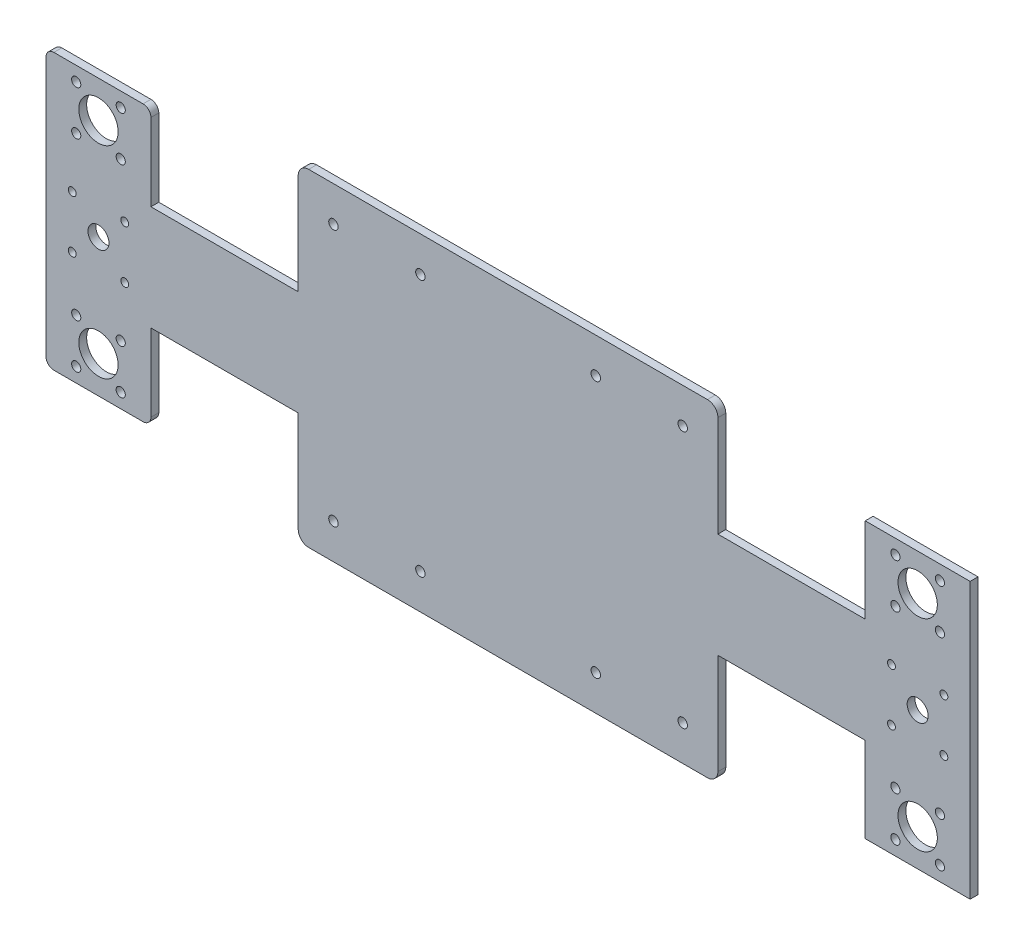
from build123d import *

# Parameters (mm, degrees)
SKETCH_1_W      = 352.3
SKETCH_1_H      = 40
SKETCH_1_R      = 4
SKETCH_1_R_2    = 1.5
EXTRUDE_1_DEPTH = 3
FILLET_1_R      = 7
SKETCH_2_R      = 1.8
EXTRUDE_2_DEPTH = 3
FILLET_2_R      = 4
SKETCH_3_R      = 1.75
SKETCH_3_R_2    = 7.5
EXTRUDE_3_DEPTH = 3
FILLET_3_R      = 3


with BuildPart() as part:
    # 스케치1 → 보스-돌출1 (new body)
    with BuildSketch(Plane.XY):
        Rectangle(SKETCH_1_W, SKETCH_1_H)
        with Locations((-156.15, 0)):
            Circle(SKETCH_1_R, mode=Mode.SUBTRACT)
        with Locations((-146.15, -10)):
            Circle(SKETCH_1_R_2, mode=Mode.SUBTRACT)
        with Locations((-146.15, 10)):
            Circle(SKETCH_1_R_2, mode=Mode.SUBTRACT)
        with Locations((-166.15, -10)):
            Circle(SKETCH_1_R_2, mode=Mode.SUBTRACT)
        with Locations((-166.15, 10)):
            Circle(SKETCH_1_R_2, mode=Mode.SUBTRACT)
        with Locations((146.15, 10)):
            Circle(SKETCH_1_R_2, mode=Mode.SUBTRACT)
        with Locations((156.15, 0)):
            Circle(SKETCH_1_R, mode=Mode.SUBTRACT)
        with Locations((146.15, -10)):
            Circle(SKETCH_1_R_2, mode=Mode.SUBTRACT)
        with Locations((166.15, -10)):
            Circle(SKETCH_1_R_2, mode=Mode.SUBTRACT)
        with Locations((166.15, 10)):
            Circle(SKETCH_1_R_2, mode=Mode.SUBTRACT)
    extrude(amount=EXTRUDE_1_DEPTH)

    # 필렛1
    fillet_1_edges = [part.edges().sort_by_distance(p)[0] for p in [
        (-176.15, -20, 1.5),
        (-176.15, 20, 1.5),
        (176.15, -20, 1.5),
        (176.15, 20, 1.5),
    ]]
    fillet(fillet_1_edges, radius=FILLET_1_R)

    # 스케치2 → 보스-돌출2 (add)
    with BuildSketch(Plane.XY.offset(3)):
        Polygon((-80, -62.43), (80, -62.43), (80, -20), (66.575, -20), (66.575, 20), (80, 20), (80, 62.43), (-80, 62.43), align=None)
        with Locations((-66.575, -49)):
            Circle(SKETCH_2_R, mode=Mode.SUBTRACT)
        with Locations((-33.425, -49)):
            Circle(SKETCH_2_R, mode=Mode.SUBTRACT)
        with Locations((33.425, -49)):
            Circle(SKETCH_2_R, mode=Mode.SUBTRACT)
        with Locations((66.575, -49)):
            Circle(SKETCH_2_R, mode=Mode.SUBTRACT)
        with Locations((66.575, 49)):
            Circle(SKETCH_2_R, mode=Mode.SUBTRACT)
        with Locations((33.425, 49)):
            Circle(SKETCH_2_R, mode=Mode.SUBTRACT)
        with Locations((-33.425, 49)):
            Circle(SKETCH_2_R, mode=Mode.SUBTRACT)
        with Locations((-66.575, 49)):
            Circle(SKETCH_2_R, mode=Mode.SUBTRACT)
    extrude(amount=-EXTRUDE_2_DEPTH)

    # 필렛2
    fillet_2_edges = [part.edges().sort_by_distance(p)[0] for p in [
        (-80, -62.43, 1.5),
        (80, -62.43, 1.5),
        (80, 62.43, 1.5),
        (-80, 62.43, 1.5),
    ]]
    fillet(fillet_2_edges, radius=FILLET_2_R)

    # 스케치3 → 보스-돌출3 (add)
    # profile 1 of 2: a face of its own
    with BuildSketch(Plane.XY.offset(3)):
        with BuildLine():
            Line((-176.15, -13), (-176.15, -52.470562748))
            Line((-176.15, -52.470562748), (-136.15, -52.470562748))
            Line((-136.15, -52.470562748), (-136.15, -20))
            Line((-136.15, -20), (-169.15, -20))
            ThreePointArc((-169.15, -20), (-174.099747468, -17.949747468), (-176.15, -13))
        make_face()
        with Locations((-164.635281374, -46.970562748)):
            Circle(SKETCH_3_R, mode=Mode.SUBTRACT)
        with Locations((-147.664718626, -46.970562748)):
            Circle(SKETCH_3_R, mode=Mode.SUBTRACT)
        with Locations((-147.664718626, -30)):
            Circle(SKETCH_3_R, mode=Mode.SUBTRACT)
        with Locations((-164.635281374, -30)):
            Circle(SKETCH_3_R, mode=Mode.SUBTRACT)
        with Locations((-156.15, -38.485281374)):
            Circle(SKETCH_3_R_2, mode=Mode.SUBTRACT)
    # profile 2 of 2: a face of its own
    with BuildSketch(Plane.XY.offset(3)):
        with BuildLine():
            Line((-176.15, 52.470562748), (-176.15, 13))
            ThreePointArc((-176.15, 13), (-174.099747468, 17.949747468), (-169.15, 20))
            Line((-169.15, 20), (-136.15, 20))
            Line((-136.15, 20), (-136.15, 52.470562748))
            Line((-136.15, 52.470562748), (-176.15, 52.470562748))
        make_face()
        with Locations((-164.635281374, 30)):
            Circle(SKETCH_3_R, mode=Mode.SUBTRACT)
        with Locations((-156.15, 38.485281374)):
            Circle(SKETCH_3_R_2, mode=Mode.SUBTRACT)
        with Locations((-164.635281374, 46.970562748)):
            Circle(SKETCH_3_R, mode=Mode.SUBTRACT)
        with Locations((-147.664718626, 30)):
            Circle(SKETCH_3_R, mode=Mode.SUBTRACT)
        with Locations((-147.664718626, 46.970562748)):
            Circle(SKETCH_3_R, mode=Mode.SUBTRACT)
    extrude_3 = extrude(amount=-EXTRUDE_3_DEPTH)

    # 필렛3
    fillet_3_edges = [part.edges().sort_by_distance(p)[0] for p in [
        (-176.15, 52.470562748, 1.5),
        (-136.15, 52.470562748, 1.5),
        (-176.15, -52.470562748, 1.5),
        (-136.15, -52.470562748, 1.5),
    ]]
    fillet(fillet_3_edges, radius=FILLET_3_R)

    # 대칭 복사1: 보스-돌출3 across plane
    add(extrude_3.mirror(Plane(origin=(0, 0, 0), x_dir=(0, 0, 1), z_dir=(1, 0, 0))))


solid = part.part
